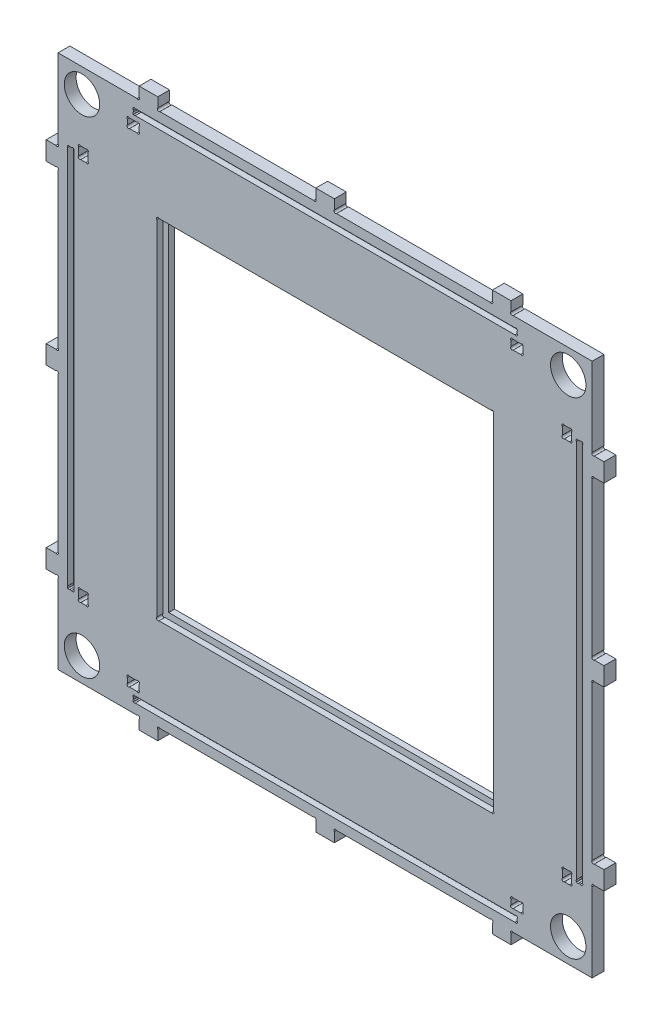
from build123d import *

# Parameters (mm, degrees)
BOSS_EXTRUDE1_OUTLINE_R = 9.525
BOSS_EXTRUDE1_OUTLINE_W = 174.6
BOSS_EXTRUDE1_OUTLINE_H = 180.95
BOSS_EXTRUDE1_DEPTH     = 6.35
CUT_EXTRUDE1_START      = -3.175
SKETCH2_W               = 174.6
SKETCH2_H               = 180.95
CUT_EXTRUDE1_DEPTH      = 3.175
SKETCH3_W               = 206.35
SKETCH3_H               = 3.302
SKETCH3_W_2             = 3.302
SKETCH3_H_2             = 206.35
CUT_EXTRUDE2_DEPTH      = 3.175


# Read off the part's stored shape, not the designer's step: Boss-Extrude1
with BuildPart() as part:
    # Boss-Extrude1 outline → Boss-Extrude1 (new body)
    with BuildSketch(Plane.XY):
        with BuildLine():
            Line((287.3, 0), (287.3, 42.527467985))
            ThreePointArc((287.3, 42.527467985), (287.3, 43.65), (288.422532015, 43.65))
            Line((288.422532015, 43.65), (293.65, 43.65))
            Line((293.65, 43.65), (293.65, 53.65))
            Line((293.65, 53.65), (288.422532015, 53.65))
            ThreePointArc((288.422532015, 53.65), (287.3, 53.65), (287.3, 54.772532015))
            Line((287.3, 54.772532015), (287.3, 137.527467985))
            ThreePointArc((287.3, 137.527467985), (287.3, 138.65), (288.422532015, 138.65))
            Line((288.422532015, 138.65), (293.65, 138.65))
            Line((293.65, 138.65), (293.65, 148.65))
            Line((293.65, 148.65), (288.422532015, 148.65))
            ThreePointArc((288.422532015, 148.65), (287.3, 148.65), (287.3, 149.772532015))
            Line((287.3, 149.772532015), (287.3, 232.527467985))
            ThreePointArc((287.3, 232.527467985), (287.3, 233.65), (288.422532015, 233.65))
            Line((288.422532015, 233.65), (293.65, 233.65))
            Line((293.65, 233.65), (293.65, 243.65))
            Line((293.65, 243.65), (288.422532015, 243.65))
            ThreePointArc((288.422532015, 243.65), (287.3, 243.65), (287.3, 244.772532015))
            Line((287.3, 244.772532015), (287.3, 287.3))
            Line((287.3, 287.3), (244.772532015, 287.3))
            ThreePointArc((244.772532015, 287.3), (243.65, 287.3), (243.65, 288.422532015))
            Line((243.65, 288.422532015), (243.65, 293.65))
            Line((243.65, 293.65), (233.65, 293.65))
            Line((233.65, 293.65), (233.65, 288.422532015))
            ThreePointArc((233.65, 288.422532015), (233.65, 287.3), (232.527467985, 287.3))
            Line((232.527467985, 287.3), (149.772532015, 287.3))
            ThreePointArc((149.772532015, 287.3), (148.65, 287.3), (148.65, 288.422532015))
            Line((148.65, 288.422532015), (148.65, 293.65))
            Line((148.65, 293.65), (138.65, 293.65))
            Line((138.65, 293.65), (138.65, 288.422532015))
            ThreePointArc((138.65, 288.422532015), (138.65, 287.3), (137.527467985, 287.3))
            Line((137.527467985, 287.3), (54.772532015, 287.3))
            ThreePointArc((54.772532015, 287.3), (53.65, 287.3), (53.65, 288.422532015))
            Line((53.65, 288.422532015), (53.65, 293.65))
            Line((53.65, 293.65), (43.65, 293.65))
            Line((43.65, 293.65), (43.65, 288.422532015))
            ThreePointArc((43.65, 288.422532015), (43.65, 287.3), (42.527467985, 287.3))
            Line((42.527467985, 287.3), (0, 287.3))
            Line((0, 287.3), (0, 244.772532015))
            ThreePointArc((0, 244.772532015), (0, 243.65), (-1.122532015, 243.65))
            Line((-1.122532015, 243.65), (-6.35, 243.65))
            Line((-6.35, 243.65), (-6.35, 233.65))
            Line((-6.35, 233.65), (-1.122532015, 233.65))
            ThreePointArc((-1.122532015, 233.65), (0, 233.65), (0, 232.527467985))
            Line((0, 232.527467985), (0, 149.772532015))
            ThreePointArc((0, 149.772532015), (0, 148.65), (-1.122532015, 148.65))
            Line((-1.122532015, 148.65), (-6.35, 148.65))
            Line((-6.35, 148.65), (-6.35, 138.65))
            Line((-6.35, 138.65), (-1.122532015, 138.65))
            ThreePointArc((-1.122532015, 138.65), (0, 138.65), (0, 137.527467985))
            Line((0, 137.527467985), (0, 54.772532015))
            ThreePointArc((0, 54.772532015), (0, 53.65), (-1.122532015, 53.65))
            Line((-1.122532015, 53.65), (-6.35, 53.65))
            Line((-6.35, 53.65), (-6.35, 43.65))
            Line((-6.35, 43.65), (-1.122532015, 43.65))
            ThreePointArc((-1.122532015, 43.65), (0, 43.65), (0, 42.527467985))
            Line((0, 42.527467985), (0, 0))
            Line((0, 0), (42.527467985, 0))
            ThreePointArc((42.527467985, 0), (43.65, 0), (43.65, -1.122532015))
            Line((43.65, -1.122532015), (43.65, -6.35))
            Line((43.65, -6.35), (53.65, -6.35))
            Line((53.65, -6.35), (53.65, -1.122532015))
            ThreePointArc((53.65, -1.122532015), (53.65, 0), (54.772532015, 0))
            Line((54.772532015, 0), (137.527467985, 0))
            ThreePointArc((137.527467985, 0), (138.65, 0), (138.65, -1.122532015))
            Line((138.65, -1.122532015), (138.65, -6.35))
            Line((138.65, -6.35), (148.65, -6.35))
            Line((148.65, -6.35), (148.65, -1.122532015))
            ThreePointArc((148.65, -1.122532015), (148.65, 0), (149.772532015, 0))
            Line((149.772532015, 0), (232.527467985, 0))
            ThreePointArc((232.527467985, 0), (233.65, 0), (233.65, -1.122532015))
            Line((233.65, -1.122532015), (233.65, -6.35))
            Line((233.65, -6.35), (243.65, -6.35))
            Line((243.65, -6.35), (243.65, -1.122532015))
            ThreePointArc((243.65, -1.122532015), (243.65, 0), (244.772532015, 0))
            Line((244.772532015, 0), (287.3, 0))
        make_face()
        with Locations((12.88713838, 12.88713838)):
            Circle(BOSS_EXTRUDE1_OUTLINE_R, mode=Mode.SUBTRACT)
        with BuildLine():
            Line((43.65, 14.964264549), (43.65, 12.20932858))
            ThreePointArc((43.65, 12.20932858), (43.65, 11.086796565), (42.527467985, 11.086796564))
            Line((42.527467985, 11.086796564), (38.422532015, 11.086796564))
            ThreePointArc((38.422532015, 11.086796564), (37.3, 11.086796564), (37.3, 12.20932858))
            Line((37.3, 12.20932858), (37.3, 14.964264549))
            ThreePointArc((37.3, 14.964264549), (37.3, 16.086796564), (38.422532015, 16.086796564))
            Line((38.422532015, 16.086796564), (42.527467985, 16.086796564))
            ThreePointArc((42.527467985, 16.086796564), (43.65, 16.086796564), (43.65, 14.964264549))
        make_face(mode=Mode.SUBTRACT)
        with BuildLine():
            Line((12.20932858, 43.65), (14.964264549, 43.65))
            ThreePointArc((14.964264549, 43.65), (16.086796564, 43.65), (16.086796564, 42.527467985))
            Line((16.086796564, 42.527467985), (16.086796564, 38.422532015))
            ThreePointArc((16.086796564, 38.422532015), (16.086796564, 37.3), (14.964264549, 37.3))
            Line((14.964264549, 37.3), (12.20932858, 37.3))
            ThreePointArc((12.20932858, 37.3), (11.086796564, 37.3), (11.086796564, 38.422532015))
            Line((11.086796564, 38.422532015), (11.086796564, 42.527467985))
            ThreePointArc((11.086796564, 42.527467985), (11.086796565, 43.65), (12.20932858, 43.65))
        make_face(mode=Mode.SUBTRACT)
        with BuildLine():
            Line((40.475, 6.369200519), (40.475, 7.299136489))
            ThreePointArc((40.475, 7.299136489), (40.475, 8.421668504), (41.597532015, 8.421668504))
            Line((41.597532015, 8.421668504), (245.702467985, 8.421668504))
            ThreePointArc((245.702467985, 8.421668504), (246.825, 8.421668504), (246.825, 7.299136489))
            Line((246.825, 7.299136489), (246.825, 6.369200519))
            ThreePointArc((246.825, 6.369200519), (246.825, 5.246668504), (245.702467985, 5.246668504))
            Line((245.702467985, 5.246668504), (41.597532015, 5.246668504))
            ThreePointArc((41.597532015, 5.246668504), (40.475, 5.246668504), (40.475, 6.369200519))
        make_face(mode=Mode.SUBTRACT)
        with BuildLine():
            Line((248.877467985, 11.086796564), (244.772532015, 11.086796564))
            ThreePointArc((244.772532015, 11.086796564), (243.65, 11.086796565), (243.65, 12.20932858))
            Line((243.65, 12.20932858), (243.65, 14.964264549))
            ThreePointArc((243.65, 14.964264549), (243.65, 16.086796564), (244.772532015, 16.086796564))
            Line((244.772532015, 16.086796564), (248.877467985, 16.086796564))
            ThreePointArc((248.877467985, 16.086796564), (250, 16.086796564), (250, 14.964264549))
            Line((250, 14.964264549), (250, 12.20932858))
            ThreePointArc((250, 12.20932858), (250, 11.086796565), (248.877467985, 11.086796564))
        make_face(mode=Mode.SUBTRACT)
        with Locations((274.41286162, 12.88713838)):
            Circle(BOSS_EXTRUDE1_OUTLINE_R, mode=Mode.SUBTRACT)
        with BuildLine():
            Line((271.213203436, 38.422532015), (271.213203436, 42.527467985))
            ThreePointArc((271.213203436, 42.527467985), (271.213203436, 43.65), (272.335735451, 43.65))
            Line((272.335735451, 43.65), (275.09067142, 43.65))
            ThreePointArc((275.09067142, 43.65), (276.213203436, 43.650000001), (276.213203436, 42.527467985))
            Line((276.213203436, 42.527467985), (276.213203436, 38.422532015))
            ThreePointArc((276.213203436, 38.422532015), (276.213203436, 37.299999999), (275.09067142, 37.3))
            Line((275.09067142, 37.3), (272.335735451, 37.3))
            ThreePointArc((272.335735451, 37.3), (271.213203436, 37.3), (271.213203436, 38.422532015))
        make_face(mode=Mode.SUBTRACT)
        with BuildLine():
            Line((16.086796564, 248.877467985), (16.086796564, 244.772532015))
            ThreePointArc((16.086796564, 244.772532015), (16.086796564, 243.65), (14.964264549, 243.65))
            Line((14.964264549, 243.65), (12.20932858, 243.65))
            ThreePointArc((12.20932858, 243.65), (11.086796565, 243.65), (11.086796564, 244.772532015))
            Line((11.086796564, 244.772532015), (11.086796564, 248.877467985))
            ThreePointArc((11.086796564, 248.877467985), (11.086796565, 250), (12.20932858, 250))
            Line((12.20932858, 250), (14.964264549, 250))
            ThreePointArc((14.964264549, 250), (16.086796564, 250), (16.086796564, 248.877467985))
        make_face(mode=Mode.SUBTRACT)
        with Locations((12.88713838, 274.41286162)):
            Circle(BOSS_EXTRUDE1_OUTLINE_R, mode=Mode.SUBTRACT)
        with BuildLine():
            Line((38.422532015, 276.213203436), (42.527467985, 276.213203436))
            ThreePointArc((42.527467985, 276.213203436), (43.650000001, 276.213203436), (43.65, 275.09067142))
            Line((43.65, 275.09067142), (43.65, 272.335735451))
            ThreePointArc((43.65, 272.335735451), (43.65, 271.213203436), (42.527467985, 271.213203436))
            Line((42.527467985, 271.213203436), (38.422532015, 271.213203436))
            ThreePointArc((38.422532015, 271.213203436), (37.3, 271.213203436), (37.3, 272.335735451))
            Line((37.3, 272.335735451), (37.3, 275.09067142))
            ThreePointArc((37.3, 275.09067142), (37.299999999, 276.213203436), (38.422532015, 276.213203436))
        make_face(mode=Mode.SUBTRACT)
        with Locations((143.65, 143.65)):
            Rectangle(BOSS_EXTRUDE1_OUTLINE_W, BOSS_EXTRUDE1_OUTLINE_H, mode=Mode.SUBTRACT)
        with BuildLine():
            Line((275.09067142, 243.65), (272.335735451, 243.65))
            ThreePointArc((272.335735451, 243.65), (271.213203436, 243.65), (271.213203436, 244.772532015))
            Line((271.213203436, 244.772532015), (271.213203436, 248.877467985))
            ThreePointArc((271.213203436, 248.877467985), (271.213203436, 250), (272.335735451, 250))
            Line((272.335735451, 250), (275.09067142, 250))
            ThreePointArc((275.09067142, 250), (276.213203435, 250.000000001), (276.213203436, 248.877467985))
            Line((276.213203436, 248.877467985), (276.213203436, 244.772532015))
            ThreePointArc((276.213203436, 244.772532015), (276.213203435, 243.649999999), (275.09067142, 243.65))
        make_face(mode=Mode.SUBTRACT)
        with BuildLine():
            Line((243.65, 272.335735451), (243.65, 275.09067142))
            ThreePointArc((243.65, 275.09067142), (243.649999999, 276.213203435), (244.772532015, 276.213203436))
            Line((244.772532015, 276.213203436), (248.877467985, 276.213203436))
            ThreePointArc((248.877467985, 276.213203436), (250.000000001, 276.213203435), (250, 275.09067142))
            Line((250, 275.09067142), (250, 272.335735451))
            ThreePointArc((250, 272.335735451), (250, 271.213203436), (248.877467985, 271.213203436))
            Line((248.877467985, 271.213203436), (244.772532015, 271.213203436))
            ThreePointArc((244.772532015, 271.213203436), (243.65, 271.213203436), (243.65, 272.335735451))
        make_face(mode=Mode.SUBTRACT)
        with Locations((274.41286162, 274.41286162)):
            Circle(BOSS_EXTRUDE1_OUTLINE_R, mode=Mode.SUBTRACT)
    extrude(amount=BOSS_EXTRUDE1_DEPTH)

    # Sketch2 → Cut-Extrude1 (cut)
    # profile 1 of 5: a face of its own
    with BuildSketch(Plane.XY.offset(6.35).offset(CUT_EXTRUDE1_START)):
        with BuildLine():
            Line((54.277308196, 49.884528923), (233.133544869, 49.884528923))
            ThreePointArc((233.133544869, 49.884528923), (234.255910031, 49.903882674), (234.236556281, 51.026247836))
            Line((234.236556281, 51.026247836), (234.236556281, 236.451195057))
            ThreePointArc((234.236556281, 236.451195057), (233.944582775, 237.452725604), (232.912600772, 237.3))
            Line((232.912600772, 237.3), (54.278011411, 237.3))
            ThreePointArc((54.278011411, 237.3), (53.155646249, 237.280646249), (53.175, 236.158281087))
            Line((53.175, 236.158281087), (53.175, 51.026926793))
            ThreePointArc((53.175, 51.026926793), (53.154955163, 49.90457376), (54.277308196, 49.884528923))
        make_face()
        with Locations((143.65, 143.65)):
            Rectangle(SKETCH2_W, SKETCH2_H, mode=Mode.SUBTRACT)
    # profile 2 of 5: a face of its own
    with BuildSketch(Plane.XY.offset(6.35).offset(CUT_EXTRUDE1_START)):
        with BuildLine():
            Line((40.475, 280.000863511), (40.475, 280.930799481))
            ThreePointArc((40.475, 280.930799481), (40.475, 282.053331496), (41.597532015, 282.053331496))
            Line((41.597532015, 282.053331496), (245.702467985, 282.053331496))
            ThreePointArc((245.702467985, 282.053331496), (246.825, 282.053331496), (246.825, 280.930799481))
            Line((246.825, 280.930799481), (246.825, 280.000863511))
            ThreePointArc((246.825, 280.000863511), (246.825, 278.878331496), (245.702467985, 278.878331496))
            Line((245.702467985, 278.878331496), (41.597532015, 278.878331496))
            ThreePointArc((41.597532015, 278.878331496), (40.475, 278.878331496), (40.475, 280.000863511))
        make_face()
    # profile 3 of 5: a face of its own
    with BuildSketch(Plane.XY.offset(6.35).offset(CUT_EXTRUDE1_START)):
        with BuildLine():
            Line((7.299136489, 40.475), (6.369200519, 40.475))
            ThreePointArc((6.369200519, 40.475), (5.246668504, 40.475), (5.246668504, 41.597532015))
            Line((5.246668504, 41.597532015), (5.246668504, 245.702467985))
            ThreePointArc((5.246668504, 245.702467985), (5.246668504, 246.825), (6.369200519, 246.825))
            Line((6.369200519, 246.825), (7.299136489, 246.825))
            ThreePointArc((7.299136489, 246.825), (8.421668504, 246.825), (8.421668504, 245.702467985))
            Line((8.421668504, 245.702467985), (8.421668504, 41.597532015))
            ThreePointArc((8.421668504, 41.597532015), (8.421668504, 40.475), (7.299136489, 40.475))
        make_face()
    # profile 4 of 5: a face of its own
    with BuildSketch(Plane.XY.offset(6.35).offset(CUT_EXTRUDE1_START)):
        with BuildLine():
            Line((280.000863511, 246.825), (280.930799481, 246.825))
            ThreePointArc((280.930799481, 246.825), (282.053331496, 246.825), (282.053331496, 245.702467985))
            Line((282.053331496, 245.702467985), (282.053331496, 41.597532015))
            ThreePointArc((282.053331496, 41.597532015), (282.053331496, 40.475), (280.930799481, 40.475))
            Line((280.930799481, 40.475), (280.000863511, 40.475))
            ThreePointArc((280.000863511, 40.475), (278.878331496, 40.475), (278.878331496, 41.597532015))
            Line((278.878331496, 41.597532015), (278.878331496, 245.702467985))
            ThreePointArc((278.878331496, 245.702467985), (278.878331496, 246.825), (280.000863511, 246.825))
        make_face()
    # profile 5 of 5: a face of its own
    with BuildSketch(Plane.XY.offset(6.35).offset(CUT_EXTRUDE1_START)):
        with BuildLine():
            Line((246.825, 7.299136489), (246.825, 6.369200519))
            ThreePointArc((246.825, 6.369200519), (246.825, 5.246668504), (245.702467985, 5.246668504))
            Line((245.702467985, 5.246668504), (41.597532015, 5.246668504))
            ThreePointArc((41.597532015, 5.246668504), (40.475, 5.246668504), (40.475, 6.369200519))
            Line((40.475, 6.369200519), (40.475, 7.299136489))
            ThreePointArc((40.475, 7.299136489), (40.475, 8.421668504), (41.597532015, 8.421668504))
            Line((41.597532015, 8.421668504), (245.702467985, 8.421668504))
            ThreePointArc((245.702467985, 8.421668504), (246.825, 8.421668504), (246.825, 7.299136489))
        make_face()
    extrude(amount=CUT_EXTRUDE1_DEPTH, mode=Mode.SUBTRACT)

    # Sketch3 → Cut-Extrude2 (cut)
    with BuildSketch(Plane.XY.offset(6.35)):
        with Locations((143.65, 280.465831496)):
            Rectangle(SKETCH3_W, SKETCH3_H)
        with Locations((280.465831496, 143.65)):
            Rectangle(SKETCH3_W_2, SKETCH3_H_2)
        with Locations((143.65, 6.834168504)):
            Rectangle(SKETCH3_W, SKETCH3_H)
        with Locations((6.834168504, 143.65)):
            Rectangle(SKETCH3_W_2, SKETCH3_H_2)
    extrude(amount=-CUT_EXTRUDE2_DEPTH, mode=Mode.SUBTRACT)


solid = part.part
